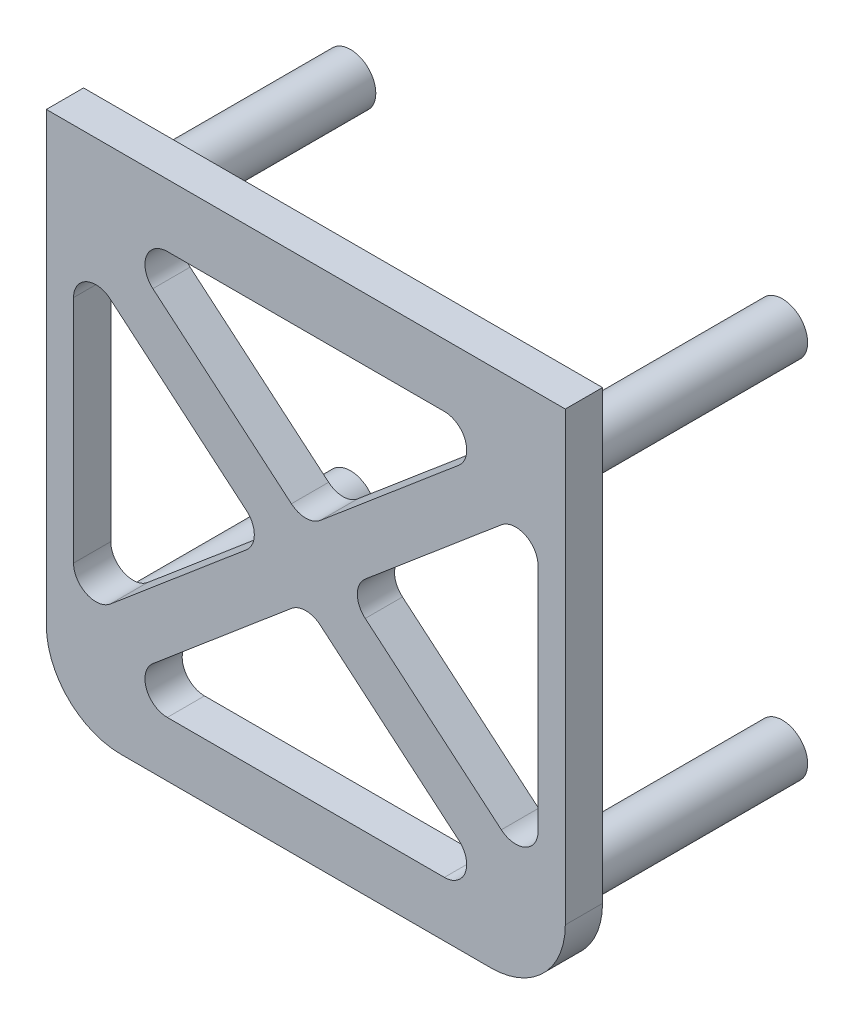
from build123d import *

# Parameters (mm, degrees)
SKETCH1_R             = 3.4
BOSS_EXTRUDE1_DEPTH   = 30
BOSS_EXTRUDE1_2_DEPTH = 30
BOSS_EXTRUDE1_3_DEPTH = 30
BOSS_EXTRUDE1_4_DEPTH = 30
BOSS_EXTRUDE2_DEPTH   = 5
CUT_EXTRUDE1_REACH    = 69.93
FILLET1_R             = 3


with BuildPart() as part:
    # Sketch1 → Boss-Extrude1 (new body)
    with BuildSketch(Plane.XY):
        with Locations((29, -40)):
            Circle(SKETCH1_R)
    extrude(amount=BOSS_EXTRUDE1_DEPTH)



with BuildPart() as body_2:
    # Sketch1 → Boss-Extrude1 2 (new body)
    with BuildSketch(Plane.XY):
        with Locations((-29, -40)):
            Circle(SKETCH1_R)
    extrude(amount=BOSS_EXTRUDE1_2_DEPTH)


with BuildPart() as body_3:
    # Sketch1 → Boss-Extrude1 3 (new body)
    with BuildSketch(Plane.XY):
        with Locations((-29, 9)):
            Circle(SKETCH1_R)
    extrude(amount=BOSS_EXTRUDE1_3_DEPTH)


with BuildPart() as body_4:
    # Sketch1 → Boss-Extrude1 4 (new body)
    with BuildSketch(Plane.XY):
        with Locations((29, 9)):
            Circle(SKETCH1_R)
    extrude(amount=BOSS_EXTRUDE1_4_DEPTH)


with BuildPart() as part_1:
    add(part.part)

    add(body_2.part)  # Boss-Extrude2 merges body 2

    add(body_3.part)  # Boss-Extrude2 merges body 3

    add(body_4.part)  # Boss-Extrude2 merges body 4
    # Sketch2 → Boss-Extrude2 (add)
    with BuildSketch(Plane.XY.offset(30)):
        with BuildLine():
            Line((-24.85, -50), (24.85, -50))
            ThreePointArc((24.85, -50), (31.921067812, -47.071067812), (34.85, -40))
            Line((34.85, -40), (34.85, 20))
            Line((34.85, 20), (-34.85, 20))
            Line((-34.85, 20), (-34.85, -40))
            ThreePointArc((-34.85, -40), (-31.921067812, -47.071067812), (-24.85, -50))
        make_face()
    extrude(amount=BOSS_EXTRUDE2_DEPTH)

    # Sketch3 → Cut-Extrude1 (cut, up to next)
    with BuildSketch(Plane(origin=(0, 0, 30), x_dir=(-1, 0, 0), z_dir=(0, 0, -1)), mode=Mode.PRIVATE) as cut_extrude1_sk1:
        Polygon((-5.268445512, -15.5), (-31.194195607, 6.402788873), (-31.194195607, -37.402788873), align=None)
    cut_extrude1_tool1 = extrude(cut_extrude1_sk1.sketch, amount=-CUT_EXTRUDE1_REACH, mode=Mode.PRIVATE) & part_1.part
    # Sketch3 → Cut-Extrude1 (cut, up to next)
    with BuildSketch(Plane(origin=(0, 0, 30), x_dir=(-1, 0, 0), z_dir=(0, 0, -1)), mode=Mode.PRIVATE) as cut_extrude1_sk2:
        Polygon((26.805804393, 11.597211127), (-26.805804393, 11.597211127), (0, -11.049071895), align=None)
    cut_extrude1_tool2 = extrude(cut_extrude1_sk2.sketch, amount=-CUT_EXTRUDE1_REACH, mode=Mode.PRIVATE) & part_1.part
    # Sketch3 → Cut-Extrude1 (cut, up to next)
    with BuildSketch(Plane(origin=(0, 0, 30), x_dir=(-1, 0, 0), z_dir=(0, 0, -1)), mode=Mode.PRIVATE) as cut_extrude1_sk3:
        Polygon((31.194195607, 6.402788873), (5.268445512, -15.5), (31.194195607, -37.402788873), align=None)
    cut_extrude1_tool3 = extrude(cut_extrude1_sk3.sketch, amount=-CUT_EXTRUDE1_REACH, mode=Mode.PRIVATE) & part_1.part
    # Sketch3 → Cut-Extrude1 (cut, up to next)
    with BuildSketch(Plane(origin=(0, 0, 30), x_dir=(-1, 0, 0), z_dir=(0, 0, -1)), mode=Mode.PRIVATE) as cut_extrude1_sk4:
        Polygon((26.805804393, -42.597211127), (0, -19.950928105), (-26.805804393, -42.597211127), align=None)
    cut_extrude1_tool4 = extrude(cut_extrude1_sk4.sketch, amount=-CUT_EXTRUDE1_REACH, mode=Mode.PRIVATE) & part_1.part
    add(cut_extrude1_tool1.solids().sort_by_distance((22.552279, -15.5, 30))[0], mode=Mode.SUBTRACT)
    add(cut_extrude1_tool2.solids().sort_by_distance((0, 4.04845, 30))[0], mode=Mode.SUBTRACT)
    add(cut_extrude1_tool3.solids().sort_by_distance((-22.552279, -15.5, 30))[0], mode=Mode.SUBTRACT)
    add(cut_extrude1_tool4.solids().sort_by_distance((0, -35.04845, 30))[0], mode=Mode.SUBTRACT)

    # Fillet1
    # the kernel refuses this fillet: 3 mm, written as the material it adds along each edge
    with BuildSketch(Plane(origin=(-31.194195607, 6.402788873, 30), x_dir=(0, -1, 0), z_dir=(0, 0, 1)), Plane(origin=(31.194195607, -37.402788873, 30), x_dir=(0, 1, 0), z_dir=(0, 0, 1))) as fillet1_piece_1:
        with BuildLine():
            CenterArc((FILLET1_R * 2.15392408777, FILLET1_R), FILLET1_R, 139.807953963, 130.192046037)
            Line((FILLET1_R * 1.39003846223, FILLET1_R * 1.64535164917), (0, 0))
            Line((0, 0), (FILLET1_R * 2.15392408777, 0))
        make_face()
    extrude(amount=5)
    with BuildSketch(Plane(origin=(-31.194195607, -37.402788873, 30), x_dir=(0, 1, 0), z_dir=(0, 0, 1)), Plane(origin=(31.194195607, 6.402788873, 30), x_dir=(0, -1, 0), z_dir=(0, 0, 1))) as fillet1_piece_2:
        with BuildLine():
            CenterArc((FILLET1_R * 2.15392408777, -FILLET1_R), FILLET1_R, 90, 130.192046037)
            Line((FILLET1_R * 1.39003846223, -FILLET1_R * 1.64535164917), (0, 0))
            Line((0, 0), (FILLET1_R * 2.15392408777, 0))
        make_face()
    extrude(amount=5)
    with BuildSketch(Plane(origin=(-5.268445512, -15.5, 30), x_dir=(-0.7638856255460464, -0.6453516491682078, 0), z_dir=(0, 0, 1))) as fillet1_piece_3:
        with BuildLine():
            CenterArc((FILLET1_R * 1.18367346939, -FILLET1_R), FILLET1_R, 90, 99.615907926)
            Line((FILLET1_R * 0.197723772944, -FILLET1_R * 1.16704249783), (0, 0))
            Line((0, 0), (FILLET1_R * 1.18367346939, 0))
        make_face()
    extrude(amount=5)
    with BuildSketch(Plane(origin=(-26.805804393, 11.597211127, 30), x_dir=(1, 0, 0), z_dir=(0, 0, 1)), Plane(origin=(26.805804393, -42.597211127, 30), x_dir=(-1, 0, 0), z_dir=(0, 0, 1))) as fillet1_piece_4:
        with BuildLine():
            CenterArc((FILLET1_R * 2.73321626716, -FILLET1_R), FILLET1_R, 90, 139.807953963)
            Line((FILLET1_R * 2.08786461799, -FILLET1_R * 1.76388562555), (0, 0))
            Line((0, 0), (FILLET1_R * 2.73321626716, 0))
        make_face()
    extrude(amount=5)
    with BuildSketch(Plane(origin=(0, -11.049071895, 30), x_dir=(0.7638856255460464, 0.6453516491682076, 0), z_dir=(0, 0, 1))) as fillet1_piece_5:
        with BuildLine():
            CenterArc((FILLET1_R * 0.844827586207, FILLET1_R), FILLET1_R, 189.615907926, 80.384092074)
            Line((-FILLET1_R * 0.141122110237, FILLET1_R * 0.832957502168), (0, 0))
            Line((0, 0), (FILLET1_R * 0.844827586207, 0))
        make_face()
    extrude(amount=5)
    with BuildSketch(Plane(origin=(26.805804393, 11.597211127, 30), x_dir=(-1, 0, 0), z_dir=(0, 0, 1)), Plane(origin=(-26.805804393, -42.597211127, 30), x_dir=(1, 0, 0), z_dir=(0, 0, 1))) as fillet1_piece_6:
        with BuildLine():
            CenterArc((FILLET1_R * 2.73321626716, FILLET1_R), FILLET1_R, 130.192046037, 139.807953963)
            Line((FILLET1_R * 2.08786461799, FILLET1_R * 1.76388562555), (0, 0))
            Line((0, 0), (FILLET1_R * 2.73321626716, 0))
        make_face()
    extrude(amount=5)
    with BuildSketch(Plane(origin=(0, -19.950928105, 30), x_dir=(0.7638856255460446, -0.6453516491682099, 0), z_dir=(0, 0, 1))) as fillet1_piece_7:
        with BuildLine():
            CenterArc((FILLET1_R * 0.844827586207, -FILLET1_R), FILLET1_R, 90, 80.384092074)
            Line((-FILLET1_R * 0.141122110237, -FILLET1_R * 0.832957502168), (0, 0))
            Line((0, 0), (FILLET1_R * 0.844827586207, 0))
        make_face()
    extrude(amount=5)
    with BuildSketch(Plane(origin=(5.268445512, -15.5, 30), x_dir=(0.7638856255460458, -0.6453516491682085, 0), z_dir=(0, 0, 1))) as fillet1_piece_8:
        with BuildLine():
            CenterArc((FILLET1_R * 1.18367346939, FILLET1_R), FILLET1_R, 170.384092074, 99.615907926)
            Line((FILLET1_R * 0.197723772944, FILLET1_R * 1.16704249783), (0, 0))
            Line((0, 0), (FILLET1_R * 1.18367346939, 0))
        make_face()
    extrude(amount=5)


solid = part_1.part
